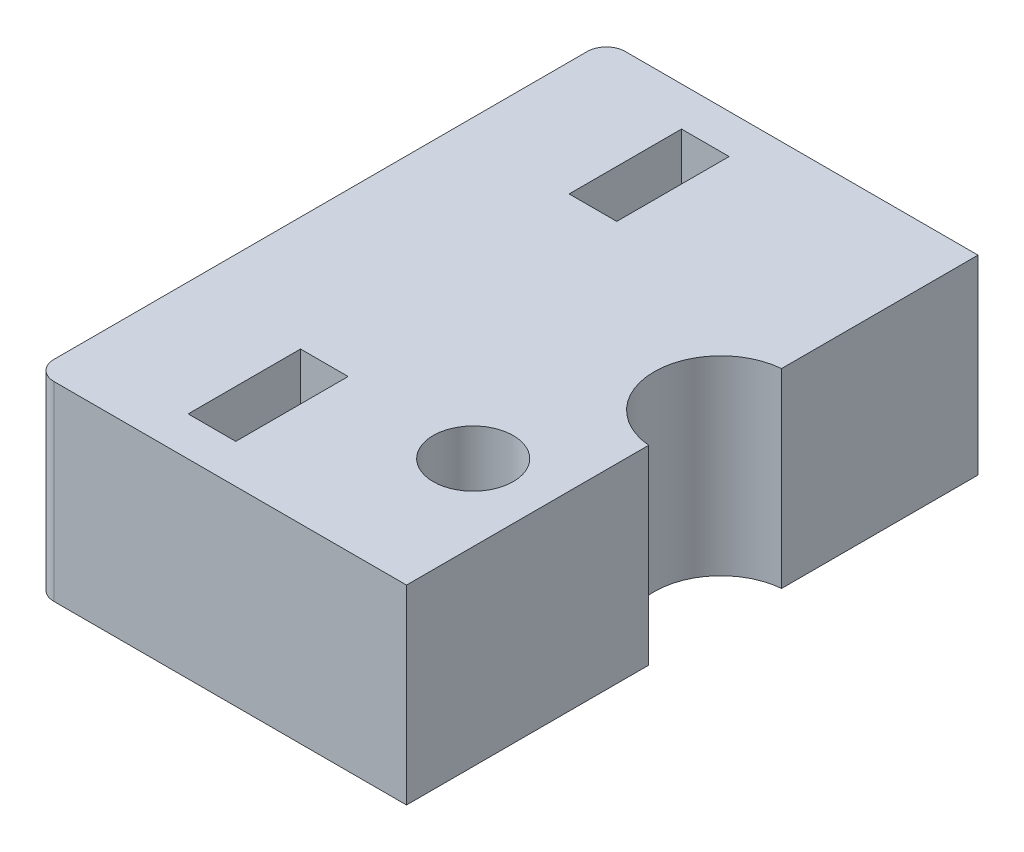
from build123d import *

# Parameters (mm, degrees)
SKETCH1_W           = 59.0272
SKETCH1_H           = 30
BOSS_EXTRUDE1_DEPTH = 10
SKETCH2_R           = 2.1
CUT_EXTRUDE1_DEPTH  = 35.58399319
SKETCH3_R           = 1.65
CUT_EXTRUDE2_DEPTH  = 12
SKETCH4_R           = 1.7
CUT_EXTRUDE3_DEPTH  = 12
CUT_EXTRUDE4_DEPTH  = 2.3
CUT_EXTRUDE5_DEPTH  = 2.5
SKETCH7_R           = 3.5
CUT_EXTRUDE6_DEPTH  = 35.58399319
FILLET1_R           = 1
SKETCH8_W           = 39.5136
SKETCH8_H           = 30
CUT_EXTRUDE7_DEPTH  = 35.58399319


with BuildPart() as part:
    # Sketch1 → Boss-Extrude1 (new body)
    with BuildSketch(Plane(origin=(0, 0, 0), x_dir=(1, 0, 0), z_dir=(0, 1, 0))):
        Rectangle(SKETCH1_W, SKETCH1_H)
    extrude(amount=BOSS_EXTRUDE1_DEPTH)

    # Sketch2 → Cut-Extrude1 (cut, through all)
    with BuildSketch(Plane(origin=(0, 10, 0), x_dir=(1, 0, 0), z_dir=(0, 1, 0))):
        with Locations((-14, -7.5)):
            Circle(SKETCH2_R)
        with Locations((6, -7.5)):
            Circle(SKETCH2_R)
    extrude(amount=-CUT_EXTRUDE1_DEPTH, mode=Mode.SUBTRACT)

    # Sketch3 → Cut-Extrude2 (cut)
    with BuildSketch(Plane(origin=(29.5136, 0, 0), x_dir=(0, 0, -1), z_dir=(1, 0, 0))):
        with Locations((-10, 5)):
            Circle(SKETCH3_R)
        with Locations((10, 5)):
            Circle(SKETCH3_R)
    extrude(amount=-CUT_EXTRUDE2_DEPTH, mode=Mode.SUBTRACT)

    # Sketch4 → Cut-Extrude3 (cut)
    with BuildSketch(Plane.ZY.offset(29.5136)):
        with Locations((-10, 5)):
            Circle(SKETCH4_R)
        with Locations((10, 5)):
            Circle(SKETCH4_R)
    extrude(amount=-CUT_EXTRUDE3_DEPTH, mode=Mode.SUBTRACT)

    # Sketch5 → Cut-Extrude4 (cut)
    with BuildSketch(Plane(origin=(23.5136, 0, 0), x_dir=(0, 0, -1), z_dir=(1, 0, 0))):
        Polygon((-12.85, 6.645448267), (-12.85, 10), (-7.15, 10), (-7.15, 6.645448267), (-7.15, 3.354551733), (-10, 1.709103466), (-12.85, 3.354551733), align=None)
        Polygon((7.15, 6.645448267), (7.15, 3.354551733), (10, 1.709103466), (12.85, 3.354551733), (12.85, 6.645448267), (12.85, 10), (7.15, 10), align=None)
    extrude(amount=-CUT_EXTRUDE4_DEPTH, mode=Mode.SUBTRACT)

    # Sketch6 → Cut-Extrude5 (cut)
    with BuildSketch(Plane.ZY.offset(23.5136)):
        Polygon((-12.95, 6.703183294), (-12.95, 10), (-7.05, 10), (-7.05, 6.703183294), (-7.05, 3.296816706), (-10, 1.593633412), (-12.95, 3.296816706), align=None)
        Polygon((7.05, 6.703183294), (7.05, 3.296816706), (10, 1.593633412), (12.95, 3.296816706), (12.95, 6.703183294), (12.95, 10), (7.05, 10), align=None)
    extrude(amount=-CUT_EXTRUDE5_DEPTH, mode=Mode.SUBTRACT)

    # Sketch7 → Cut-Extrude6 (cut, through all)
    with BuildSketch(Plane(origin=(0, 10, 0), x_dir=(1, 0, 0), z_dir=(0, 1, 0))):
        with Locations((15.7, 1.2)):
            Circle(SKETCH7_R)
        with Locations((-9.7, 1.2)):
            Circle(SKETCH7_R)
    extrude(amount=-CUT_EXTRUDE6_DEPTH, mode=Mode.SUBTRACT)

    # Fillet1
    fillet1_edges = [part.edges().sort_by_distance(p)[0] for p in [
        (-29.5136, 5, 15),
        (-29.5136, 5, -15),
        (29.5136, 5, -15),
        (29.5136, 5, 15),
    ]]
    fillet(fillet1_edges, radius=FILLET1_R)

    # Sketch8 → Cut-Extrude7 (cut, through all)
    with BuildSketch(Plane(origin=(0, 10, 0), x_dir=(1, 0, 0), z_dir=(0, 1, 0))):
        with Locations((9.7568, 0)):
            Rectangle(SKETCH8_W, SKETCH8_H)
    extrude(amount=-CUT_EXTRUDE7_DEPTH, mode=Mode.SUBTRACT)


solid = part.part
